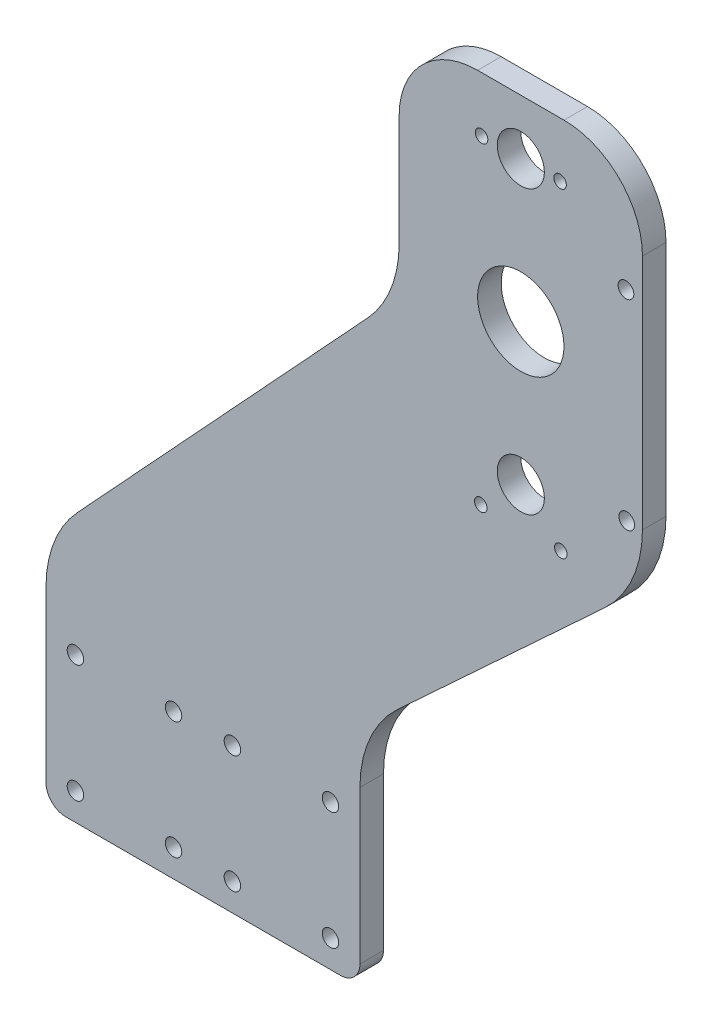
from build123d import *

# Parameters (mm, degrees)
SKETCH1_R           = 2.1
SKETCH1_R_2         = 6
SKETCH1_R_3         = 11
SKETCH1_R_4         = 2
SKETCH1_R_5         = 1.6
BOSS_EXTRUDE1_DEPTH = 6


with BuildPart() as part:
    # Sketch1 → Boss-Extrude1 (new body)
    with BuildSketch(Plane.XY):
        with BuildLine():
            Line((-58.426247288, -99.197523475), (11.573752712, -99.197523475))
            ThreePointArc((11.573752712, -99.197523475), (15.109286618, -97.733057381), (16.573752712, -94.197523475))
            Line((16.573752712, -94.197523475), (16.573752712, -55.206132823))
            ThreePointArc((16.573752712, -55.206132823), (19.086141827, -43.188177597), (26.202502566, -33.18314103))
            Line((26.202502566, -33.18314103), (78.945002858, 15.603630397))
            ThreePointArc((78.945002858, 15.603630397), (86.061363597, 25.608666964), (88.573752712, 37.62662219))
            Line((88.573752712, 37.62662219), (88.573752712, 98.05237335))
            ThreePointArc((88.573752712, 98.05237335), (82.715888336, 112.194508974), (68.573752712, 118.05237335))
            Line((68.573752712, 118.05237335), (46.573752712, 118.05237335))
            ThreePointArc((46.573752712, 118.05237335), (32.431617088, 112.194508974), (26.573752712, 98.05237335))
            Line((26.573752712, 98.05237335), (26.573752712, 69.804033413))
            ThreePointArc((26.573752712, 69.804033413), (24.507075321, 58.861936355), (18.591786844, 49.427424937))
            Line((18.591786844, 49.427424937), (-55.44428142, -30.572575063))
            ThreePointArc((-55.44428142, -30.572575063), (-61.359569897, -40.00708648), (-63.426247288, -50.949183538))
            Line((-63.426247288, -50.949183538), (-63.426247288, -94.197523475))
            ThreePointArc((-63.426247288, -94.197523475), (-61.961781194, -97.733057381), (-58.426247288, -99.197523475))
        make_face()
        with Locations((-55.926247288, -62.197523475)):
            Circle(SKETCH1_R, mode=Mode.SUBTRACT)
        with Locations((-30.926247288, -62.197523475)):
            Circle(SKETCH1_R, mode=Mode.SUBTRACT)
        with Locations((-30.926247288, -92.197523475)):
            Circle(SKETCH1_R, mode=Mode.SUBTRACT)
        with Locations((-55.926247288, -92.197523475)):
            Circle(SKETCH1_R, mode=Mode.SUBTRACT)
        with Locations((9.073752712, -92.197523475)):
            Circle(SKETCH1_R, mode=Mode.SUBTRACT)
        with Locations((-15.926247288, -92.197523475)):
            Circle(SKETCH1_R, mode=Mode.SUBTRACT)
        with Locations((-15.926247288, -62.197523475)):
            Circle(SKETCH1_R, mode=Mode.SUBTRACT)
        with Locations((9.073752712, -62.197523475)):
            Circle(SKETCH1_R, mode=Mode.SUBTRACT)
        with Locations((57.573752712, 104.05237335)):
            Circle(SKETCH1_R_2, mode=Mode.SUBTRACT)
        with Locations((57.573752712, 32.11237335)):
            Circle(SKETCH1_R_2, mode=Mode.SUBTRACT)
        with Locations((57.573752712, 68.08237335)):
            Circle(SKETCH1_R_3, mode=Mode.SUBTRACT)
        with Locations((84.573752712, 37.62662219)):
            Circle(SKETCH1_R_4, mode=Mode.SUBTRACT)
        with Locations((84.375885899, 88.528341433)):
            Circle(SKETCH1_R_4, mode=Mode.SUBTRACT)
        with Locations((47.573752712, 104.05237335)):
            Circle(SKETCH1_R_5, mode=Mode.SUBTRACT)
        with Locations((47.375885899, 22.588341433)):
            Circle(SKETCH1_R_5, mode=Mode.SUBTRACT)
        with Locations((67.573752712, 104.05237335)):
            Circle(SKETCH1_R_5, mode=Mode.SUBTRACT)
        with Locations((67.771619525, 22.588341433)):
            Circle(SKETCH1_R_5, mode=Mode.SUBTRACT)
    extrude(amount=BOSS_EXTRUDE1_DEPTH)


solid = part.part
